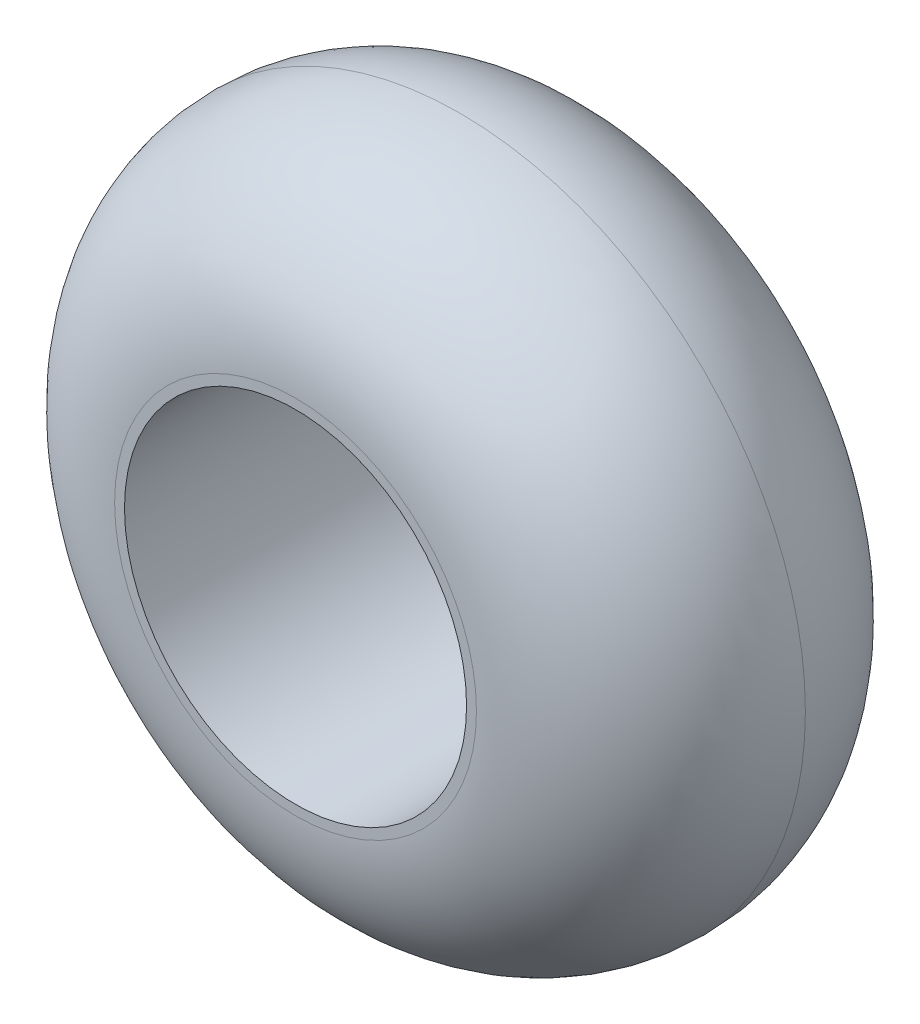
from build123d import *

# Parameters (mm, degrees)
ESQUISSE1_R        = 5.25
ESQUISSE1_R_2      = 2.6
BOSS_EXTRU_1_DEPTH = 5
CONG_1_R           = 2.5


with BuildPart() as part:
    # Esquisse1 → Boss.-Extru.1 (new body)
    with BuildSketch(Plane.XY):
        Circle(ESQUISSE1_R)
        Circle(ESQUISSE1_R_2, mode=Mode.SUBTRACT)
    extrude(amount=BOSS_EXTRU_1_DEPTH)

    # Congé1
    cong_1_edges = [part.edges().sort_by_distance(p)[0] for p in [
        (-5.25, 0, 0),
        (-5.25, 0, 5),
    ]]
    fillet(cong_1_edges, radius=CONG_1_R - 0.0001)  # a hair under: the kernel refuses the full size


solid = part.part
